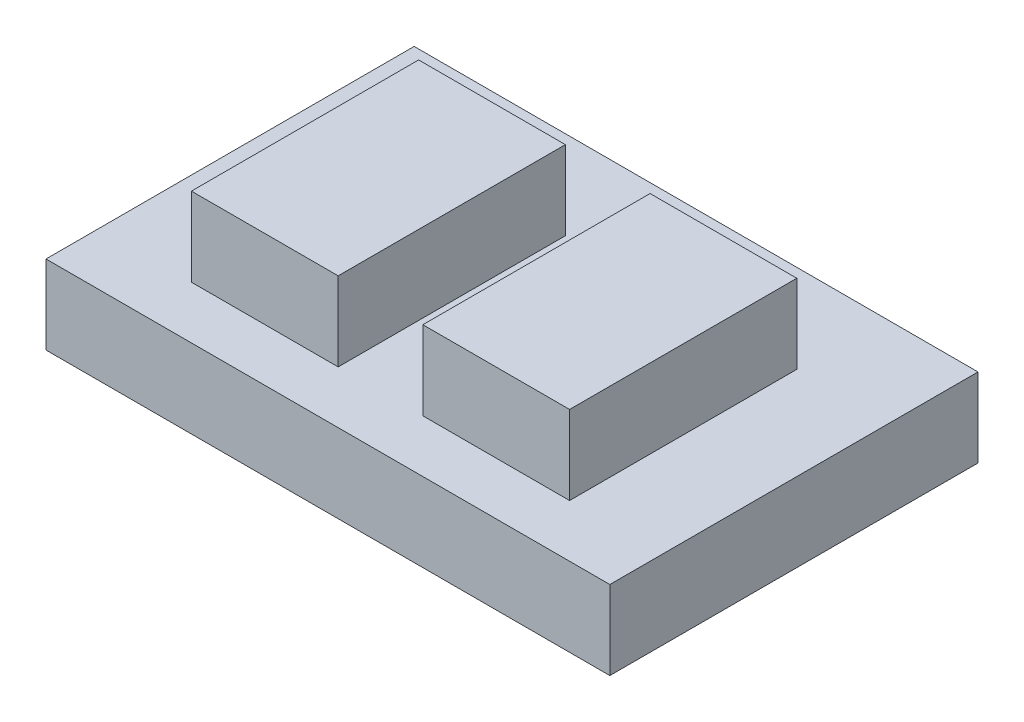
from build123d import *

# Parameters (mm, degrees)
SKETCH1_W           = 10.72
SKETCH1_H           = 7
BOSS_EXTRUDE1_DEPTH = 1.5
SKETCH2_W           = 2.79
SKETCH2_H           = 4.32
BOSS_EXTRUDE2_DEPTH = 1.5


with BuildPart() as part:
    # Sketch1 → Boss-Extrude1 (new body)
    with BuildSketch(Plane(origin=(0, 0, 0), x_dir=(1, 0, 0), z_dir=(0, 1, 0))):
        with Locations((-1.001063444, -0.897435897)):
            Rectangle(SKETCH1_W, SKETCH1_H)
    extrude(amount=BOSS_EXTRUDE1_DEPTH)

    # Sketch2 → Boss-Extrude2 (add)
    with BuildSketch(Plane(origin=(0, 1.5, 0), x_dir=(1, 0, 0), z_dir=(0, 1, 0))):
        with Locations((-3.201063444, -1.237435897)):
            Rectangle(SKETCH2_W, SKETCH2_H)
        with Locations((1.198936556, -1.237435897)):
            Rectangle(SKETCH2_W, SKETCH2_H)
    extrude(amount=BOSS_EXTRUDE2_DEPTH)


solid = part.part
